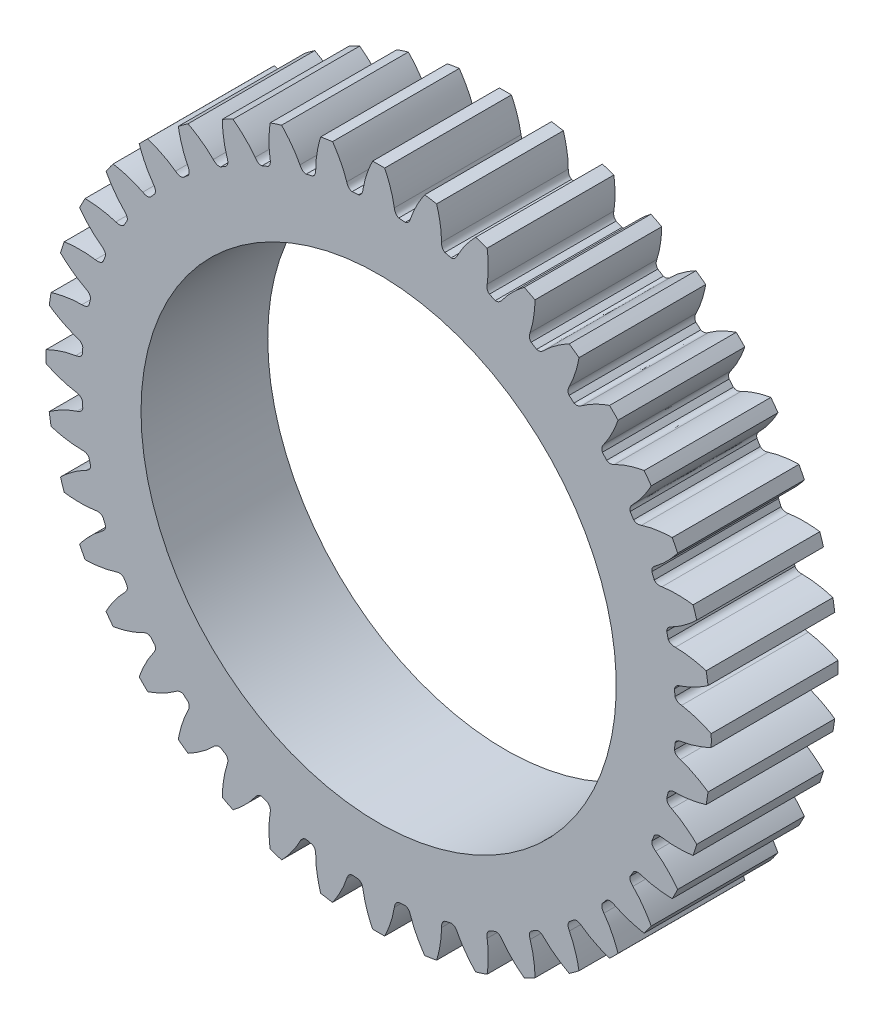
from build123d import *

# Parameters (mm, degrees)
SKETCH_1_R               = 18.75
EXTRUDE_1_DEPTH          = 8
EXTRUDE_6_DEPTH          = 8
PATTERN_CIRCULAR_1_COUNT = 40
SKETCH_3_R               = 15
CUT_EXTRUDE_1_DEPTH      = 8


with BuildPart() as part:
    # 스케치1 → 보스-돌출1 (new body)
    with BuildSketch(Plane.XY):
        Circle(SKETCH_1_R)
    extrude(amount=EXTRUDE_1_DEPTH)

    # 스케치2 → 보스-돌출6 (add)
    with BuildSketch(Plane(origin=(0, 0, 0), x_dir=(-1, 0, 0), z_dir=(0, 0, -1))):
        with BuildLine():
            ThreePointArc((-0.380263552, 20.993917017), (-3.39e-07, 20.997322717), (0.380262196, 20.993842145))
            add(Edge.make_bspline(
                [(0.990553602, 19.122542741), (0.974942302, 19.232196085), (0.941968354, 19.408897542), (0.8814999, 19.659294758), (0.81806723, 19.884291096), (0.73787189, 20.13246963), (0.600127654, 20.50909253), (0.475327782, 20.797538453), (0.380262196, 20.993842145)],
                knots=[0, 0, 0, 0, 0.168181091, 0.27280386, 0.391114777, 0.523113844, 0.66880106, 1, 1, 1, 1], degree=3))
            add(Edge.make_bspline(
                [(0.990553602, 19.122542741), (0.996375329, 19.08174195), (1.008181028, 19.021493627), (1.033827007, 18.943876608), (1.059579052, 18.886690333), (1.096035129, 18.829027031), (1.174131324, 18.742988208), (1.266672691, 18.711955869), (1.32124842, 18.67472955)],
                knots=[0, 0, 0, 0, 0.210011783, 0.311637377, 0.415791059, 0.528523395, 0.658273692, 1, 1, 1, 1], degree=3))
            ThreePointArc((1.32124842, 18.67472955), (-0.007768221, 18.721549247), (-1.336756108, 18.673920335))
            add(Edge.make_bspline(
                [(-0.990553602, 19.122542741), (-0.996374964, 19.08174132), (-1.008181727, 19.021494833), (-1.033825985, 18.943874845), (-1.059583131, 18.886697368), (-1.096017444, 18.828996527), (-1.177474947, 18.739691634), (-1.275306539, 18.707415454), (-1.336756108, 18.673920335)],
                knots=[0, 0, 0, 0, 0.205092052, 0.304336967, 0.406050747, 0.516142217, 0.642852986, 1, 1, 1, 1], degree=3))
            add(Edge.make_bspline(
                [(-0.990553602, 19.122542741), (-0.9749423, 19.232196083), (-0.94196836, 19.408897545), (-0.881499887, 19.659294752), (-0.818067287, 19.884291122), (-0.73787164, 20.132469515), (-0.600121523, 20.509114405), (-0.475301831, 20.797576113), (-0.380263552, 20.993917017)],
                knots=[0, 0, 0, 0, 0.168175343, 0.272794535, 0.391101409, 0.523095964, 0.668778201, 1, 1, 1, 1], degree=3))
        make_face()
    extrude_6 = extrude(amount=-EXTRUDE_6_DEPTH)

    # 원형 패턴1: 보스-돌출6 ×40 about axis
    pattern_circular_1_axis = Axis((0, 0, 8), (0, 0, -1))
    for i in range(1, PATTERN_CIRCULAR_1_COUNT):
        add(extrude_6.rotate(pattern_circular_1_axis, i * 360 / PATTERN_CIRCULAR_1_COUNT))

    # 스케치3 → 컷-돌출1 (cut)
    with BuildSketch(Plane(origin=(0, 0, 0), x_dir=(-1, 0, 0), z_dir=(0, 0, -1))):
        Circle(SKETCH_3_R)
    extrude(amount=-CUT_EXTRUDE_1_DEPTH, mode=Mode.SUBTRACT)


solid = part.part
